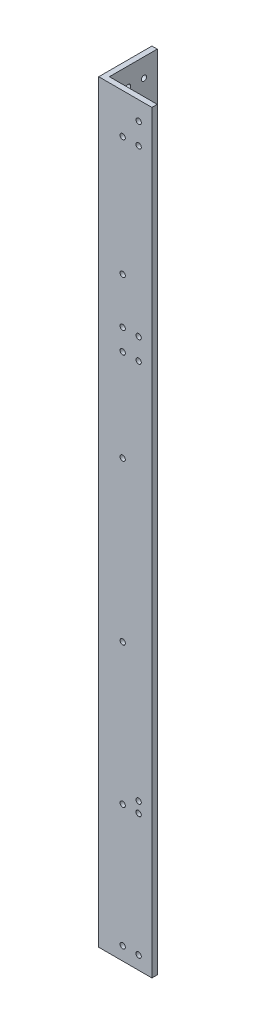
from build123d import *

# Parameters (mm, degrees)
BOSS_EXTRUDE1_DEPTH               = 450
RIGHTSIDEHOLES_SKETCH3_R          = 1.5875
RIGHTSIDEHOLES_CUT_EXTRUDE1_DEPTH = 3.175
FRONTSIDEHOLES_SKETCH4_R          = 1.5875
FRONTSIDEHOLES_SKETCH4_R_2        = 2
FRONTSIDEHOLES_CUT_EXTRUDE2_DEPTH = 3.175


with BuildPart() as part:
    # Sketch2 → Boss-Extrude1 (new body)
    with BuildSketch(Plane(origin=(0, 0, 0), x_dir=(1, 0, 0), z_dir=(0, 1, 0))):
        Polygon((0, 31.75), (3.175, 31.75), (3.175, 3.175), (31.75, 3.175), (31.75, 0), (0, 0), align=None)
    extrude(amount=BOSS_EXTRUDE1_DEPTH)

    # RightSideHoles-Sketch3 → RightSideHoles-Cut-Extrude1 (cut)
    with BuildSketch(Plane.XY):
        with Locations((14.2875, 81.1125)):
            Circle(RIGHTSIDEHOLES_SKETCH3_R)
        with Locations((23.8125, 81.1125)):
            Circle(RIGHTSIDEHOLES_SKETCH3_R)
        with Locations((23.8125, 87.4625)):
            Circle(RIGHTSIDEHOLES_SKETCH3_R)
        with Locations((14.2875, 426.1875)):
            Circle(RIGHTSIDEHOLES_SKETCH3_R)
        with Locations((23.8125, 438.8875)):
            Circle(RIGHTSIDEHOLES_SKETCH3_R)
        with Locations((23.8125, 426.1875)):
            Circle(RIGHTSIDEHOLES_SKETCH3_R)
        with Locations((14.2875, 327.602644)):
            Circle(RIGHTSIDEHOLES_SKETCH3_R)
        with Locations((23.8125, 327.602644)):
            Circle(RIGHTSIDEHOLES_SKETCH3_R)
        with Locations((14.2875, 314.902644)):
            Circle(RIGHTSIDEHOLES_SKETCH3_R)
        with Locations((23.8125, 314.902644)):
            Circle(RIGHTSIDEHOLES_SKETCH3_R)
        with Locations((14.2875, 7.9375)):
            Circle(RIGHTSIDEHOLES_SKETCH3_R)
        with Locations((23.8125, 7.9375)):
            Circle(RIGHTSIDEHOLES_SKETCH3_R)
        with Locations((14.2875, 165)):
            Circle(RIGHTSIDEHOLES_SKETCH3_R)
        with Locations((14.2875, 260)):
            Circle(RIGHTSIDEHOLES_SKETCH3_R)
        with Locations((14.2875, 355)):
            Circle(RIGHTSIDEHOLES_SKETCH3_R)
    extrude(amount=-RIGHTSIDEHOLES_CUT_EXTRUDE1_DEPTH, mode=Mode.SUBTRACT)

    # FrontSideHoles-Sketch4 → FrontSideHoles-Cut-Extrude2 (cut)
    with BuildSketch(Plane.ZY):
        with Locations((-23.8125, 81.1125)):
            Circle(FRONTSIDEHOLES_SKETCH4_R)
        with Locations((-23.8125, 87.4625)):
            Circle(FRONTSIDEHOLES_SKETCH4_R)
        with Locations((-14.2875, 87.4625)):
            Circle(FRONTSIDEHOLES_SKETCH4_R)
        with Locations((-23.8125, 438.8875)):
            Circle(FRONTSIDEHOLES_SKETCH4_R)
        with Locations((-14.2875, 438.8875)):
            Circle(FRONTSIDEHOLES_SKETCH4_R)
        with Locations((-23.8125, 426.1875)):
            Circle(FRONTSIDEHOLES_SKETCH4_R)
        with Locations((-14.2875, 333.177644)):
            Circle(FRONTSIDEHOLES_SKETCH4_R_2)
        with Locations((-14.2875, 314.652644)):
            Circle(FRONTSIDEHOLES_SKETCH4_R_2)
        with Locations((-14.2875, 165)):
            Circle(FRONTSIDEHOLES_SKETCH4_R)
        with Locations((-14.2875, 260)):
            Circle(FRONTSIDEHOLES_SKETCH4_R)
        with Locations((-14.2875, 355)):
            Circle(FRONTSIDEHOLES_SKETCH4_R)
        with Locations((-23.8125, 7.9375)):
            Circle(FRONTSIDEHOLES_SKETCH4_R)
        with Locations((-14.2875, 7.9375)):
            Circle(FRONTSIDEHOLES_SKETCH4_R)
    extrude(amount=-FRONTSIDEHOLES_CUT_EXTRUDE2_DEPTH, mode=Mode.SUBTRACT)


solid = part.part
